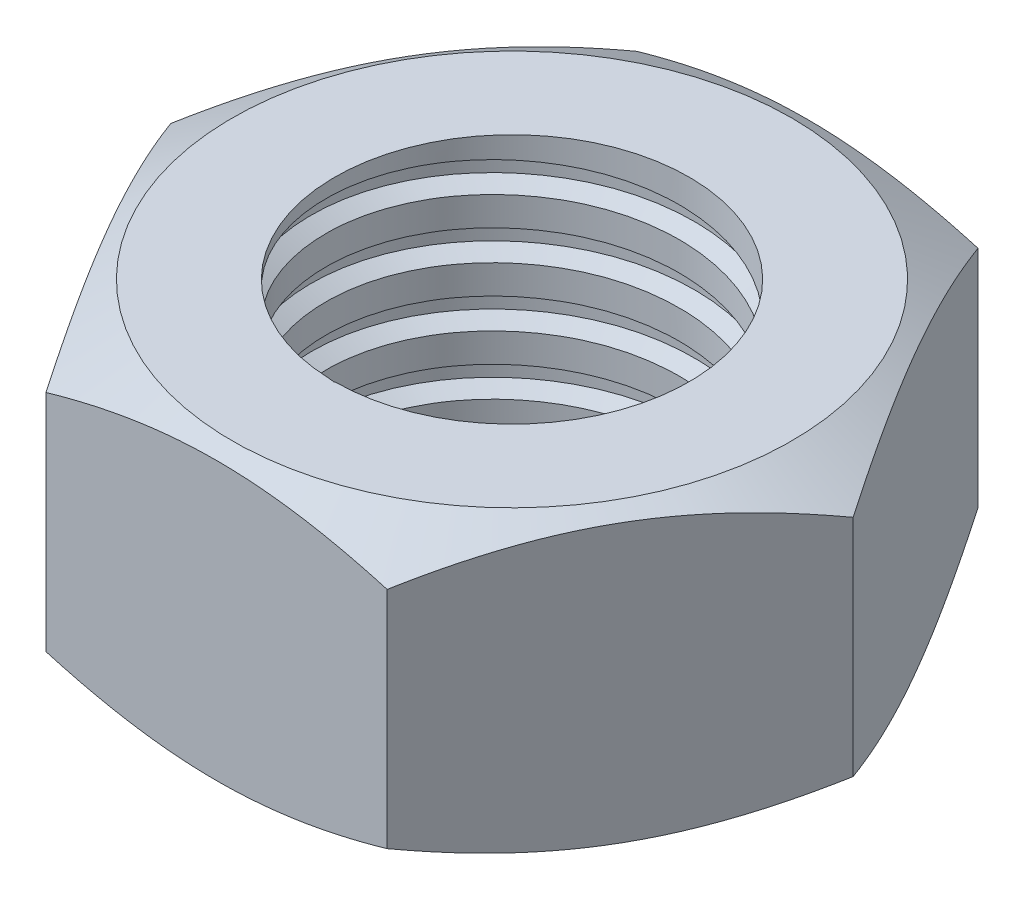
from build123d import *

# Parameters (mm, degrees)
EXTRUDE_1_DEPTH     = 2.5
SKETCH_3_R          = 1.5
CUT_EXTRUDE_1_DEPTH = 5.564354646
SWEEP_7_PITCH       = 0.5


with BuildPart() as part:
    # 草圖2 → 填料-伸長1 (new body)
    with BuildSketch(Plane(origin=(0, 0, 0), x_dir=(1, 0, 0), z_dir=(0, 1, 0))):
        Polygon((2.886751346, 0), (1.443375673, 2.5), (-1.443375673, 2.5), (-2.886751346, 0), (-1.443375673, -2.5), (1.443375673, -2.5), align=None)
    extrude(amount=EXTRUDE_1_DEPTH)

    # 草圖3 → 除料-伸長1 (cut, through all)
    with BuildSketch(Plane(origin=(0, 2.5, 0), x_dir=(1, 0, 0), z_dir=(0, 1, 0))):
        with Locations(Location((0, 0, 0), (0, 0, 270))):
            Circle(SKETCH_3_R)
    extrude(amount=-CUT_EXTRUDE_1_DEPTH, mode=Mode.SUBTRACT)

    # 草圖4 → 除料-旋轉1 (revolve, cut)
    with BuildSketch(Plane.XY, mode=Mode.PRIVATE) as cut_revolve_1_sk:
        Polygon((2.367136104, 2.5), (2.886751346, 2.2), (2.886751346, 2.5), align=None)
        Polygon((2.886751346, 0), (2.367136104, 0), (2.886751346, 0.3), align=None)
    revolve(cut_revolve_1_sk.sketch.rotate(Axis((0, 0, 0), (0, 1, 0)), 299.999999912), axis=Axis((0, 0, 0), (0, 1, 0)), mode=Mode.SUBTRACT)

    # 除料-掃出7: arcs per turn and ends read off the stored shape
    # 除料-掃出7: the profile of 草圖6 screwed along a right-hand helix through 5.75 turns, 6 arcs to a turn; built about Z, then put on its axis
    sweep_7_z = Axis((0, 0, 0), (0, 0, 1))
    sweep_7_corners = [(1.625, 0, -0.444337567), (1.625, 0, -0.555662433), (1.375, 0, -0.7), (1.375, 0, -0.3)]
    with BuildLine(mode=Mode.PRIVATE) as sweep_7_profile:
        Line(sweep_7_corners[0], sweep_7_corners[1])
        Line(sweep_7_corners[1], sweep_7_corners[2])
        Line(sweep_7_corners[2], sweep_7_corners[3])
        Line(sweep_7_corners[3], sweep_7_corners[0])
    sweep_7_cap = Face(sweep_7_profile.wire())
    sweep_7_turn_angles = [0, 30, 60, 90, 120, 150, 180, 210, 240, 270, 300, 330, 360]
    sweep_7_turn_weights = [1, 0.8660254037844387, 1, 0.8660254037844387, 1, 0.8660254037844387, 1, 0.8660254037844387, 1, 0.8660254037844387, 1, 0.8660254037844387, 1]
    sweep_7_turn_rails = [Edge.make_bspline([Vector(p[0], p[1], 0).rotate(sweep_7_z, sweep_7_turn_angles[k]) / sweep_7_turn_weights[k] + Vector(0, 0, p[2] + SWEEP_7_PITCH * sweep_7_turn_angles[k] / 360) for k in range(13)], [0, 0, 0, 1, 1, 2, 2, 3, 3, 4, 4, 5, 5, 6, 6, 6], 2, sweep_7_turn_weights) for p in sweep_7_corners]
    sweep_7_turn_sides = [Face.make_surface_from_curves(sweep_7_turn_rails[p[0]], sweep_7_turn_rails[p[1]]) for p in [(0, 1), (1, 2), (2, 3), (3, 0)]]
    sweep_7_last_angles = [1800, 1830, 1860, 1890, 1920, 1950, 1980, 2010, 2040, 2055, 2070]
    sweep_7_last_weights = [1, 0.8660254037844387, 1, 0.8660254037844387, 1, 0.8660254037844387, 1, 0.8660254037844387, 1, 0.9659258262890683, 1]
    sweep_7_last_rails = [Edge.make_bspline([Vector(p[0], p[1], 0).rotate(sweep_7_z, sweep_7_last_angles[k]) / sweep_7_last_weights[k] + Vector(0, 0, p[2] + SWEEP_7_PITCH * sweep_7_last_angles[k] / 360) for k in range(11)], [0, 0, 0, 1, 1, 2, 2, 3, 3, 4, 4, 5, 5, 5], 2, sweep_7_last_weights) for p in sweep_7_corners]
    sweep_7_last_sides = [Face.make_surface_from_curves(sweep_7_last_rails[p[0]], sweep_7_last_rails[p[1]]) for p in [(0, 1), (1, 2), (2, 3), (3, 0)]]
    sweep_7 = Plane(origin=(0, 0, 0), x_dir=(1, 0, 0), z_dir=(0, 1, 0)) * Solid(Shell([*[p.moved(Location((0, 0, SWEEP_7_PITCH * i))) for i in range(5) for p in sweep_7_turn_sides], *sweep_7_last_sides, sweep_7_cap, sweep_7_cap.rotate(sweep_7_z, 2070).moved(Location((0, 0, SWEEP_7_PITCH * 2070 / 360)))]))
    add(sweep_7, mode=Mode.SUBTRACT)


solid = part.part
